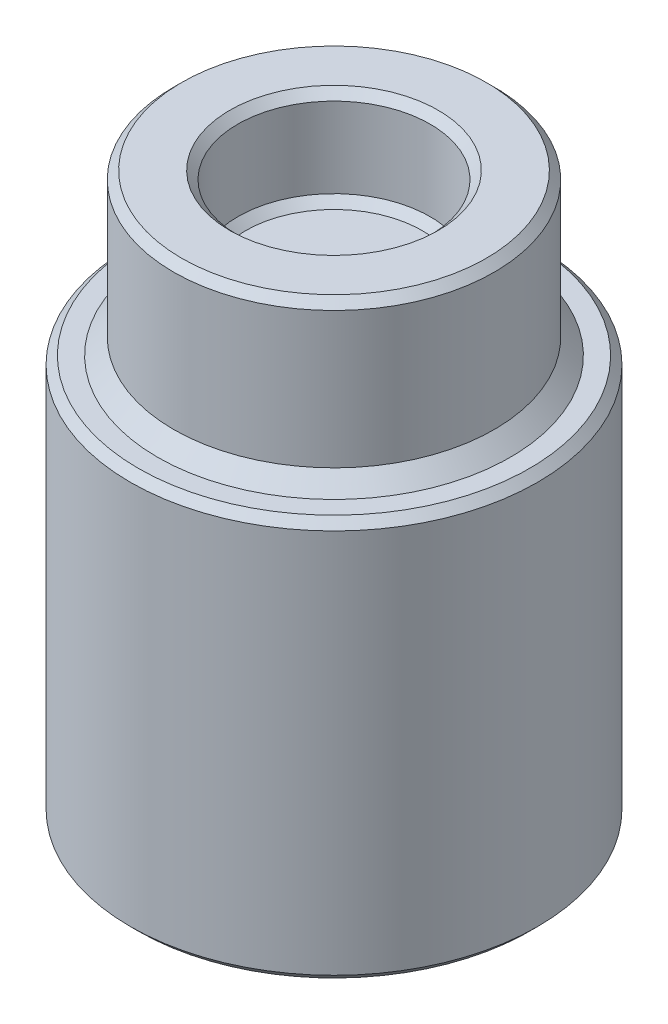
from build123d import *

# Parameters (mm, degrees)
SKETCH1_R                       = 5
BOSS_EXTRUDE1_DEPTH             = 2
SKETCH1_3_R                     = 5
SKETCH1_3_R_2                   = 3
BOSS_EXTRUDE2_DEPTH             = 5
CHAMFER1_SIZE                   = 0.25
SKETCH5_R                       = 6.35
BOSS_EXTRUDE4_DEPTH             = 12.5
F_8_0MM_DOWEL_HOLE1_D           = 8
F_8_0MM_DOWEL_HOLE1_DEPTH       = 12.150045346
F_8_0MM_DOWEL_HOLE1_CSINK_D     = 9
F_8_0MM_DOWEL_HOLE1_CSINK_ANGLE = 90
F_8_0MM_DOWEL_HOLE1_TIP         = 0.349954654
CHAMFER2_SIZE                   = 0.25
CHAMFER3_SIZE                   = 0.5


with BuildPart() as part:
    # Sketch1 → Boss-Extrude1 (new body)
    with BuildSketch(Plane(origin=(0, 0, 0), x_dir=(1, 0, 0), z_dir=(0, 1, 0))):
        Circle(SKETCH1_R)
    extrude(amount=BOSS_EXTRUDE1_DEPTH)

    # Sketch1<3> → Boss-Extrude2 (add)
    with BuildSketch(Plane(origin=(0, 0, 0), x_dir=(1, 0, 0), z_dir=(0, 1, 0))):
        Circle(SKETCH1_3_R)
        Circle(SKETCH1_3_R_2, mode=Mode.SUBTRACT)
    extrude(amount=BOSS_EXTRUDE2_DEPTH)

    # Chamfer1
    chamfer1_edges = [part.edges().sort_by_distance(p)[0] for p in [
        (-3, 5, 0),
        (-5, 5, 0),
        (-3, 2, 0),
    ]]
    chamfer(chamfer1_edges, length=CHAMFER1_SIZE)

    # Sketch5 → Boss-Extrude4 (add)
    with BuildSketch(Plane(origin=(0, 0, 0), x_dir=(1, 0, 0), z_dir=(0, 1, 0))):
        Circle(SKETCH5_R)
    extrude(amount=-BOSS_EXTRUDE4_DEPTH)

    # Ø8.0mm Dowel Hole1
    with Locations(Plane(origin=(0, -12.5, 0), x_dir=(-1, 0, 0), z_dir=(0, -1, 0))):
        with Locations((0, 0)):
            CounterSinkHole(F_8_0MM_DOWEL_HOLE1_D / 2, F_8_0MM_DOWEL_HOLE1_CSINK_D / 2, depth=F_8_0MM_DOWEL_HOLE1_DEPTH, counter_sink_angle=F_8_0MM_DOWEL_HOLE1_CSINK_ANGLE)
            with Locations((0, 0, -(F_8_0MM_DOWEL_HOLE1_DEPTH + F_8_0MM_DOWEL_HOLE1_TIP / 2))):  # 170° drill point
                Cone(0, F_8_0MM_DOWEL_HOLE1_D / 2, F_8_0MM_DOWEL_HOLE1_TIP, mode=Mode.SUBTRACT)

    # Chamfer2
    chamfer2_edges = [part.edges().sort_by_distance(p)[0] for p in [
        (-6.35, -12.5, 0),
        (-6.35, 0, 0),
    ]]
    chamfer(chamfer2_edges, length=CHAMFER2_SIZE)

    # Chamfer3
    chamfer3_edges = [part.edges().sort_by_distance(p)[0] for p in [
        (-5, 0, 0),
    ]]
    chamfer(chamfer3_edges, length=CHAMFER3_SIZE)


solid = part.part
